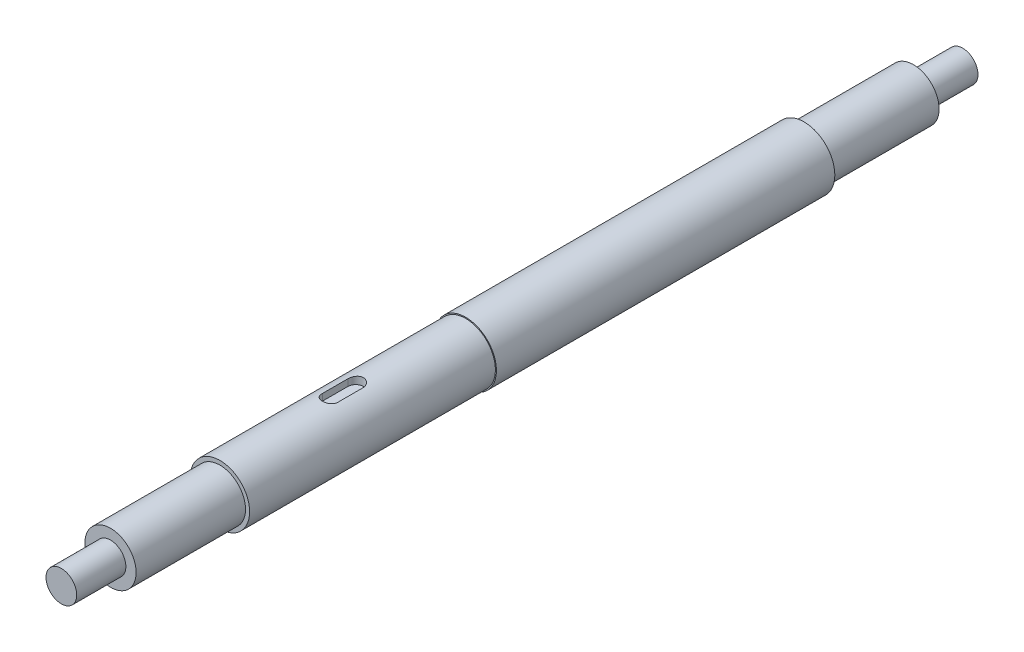
from build123d import *

# Parameters (mm, degrees)
SKETCH1_R           = 9.525
BOSS_EXTRUDE1_DEPTH = 139.7
CUT_EXTRUDE1_REACH  = 232.645
SKETCH3_R           = 9.525
SKETCH3_R_2         = 7.9375
CUT_EXTRUDE2_REACH  = 266.503
SKETCH4_R           = 7.9375
SKETCH4_R_2         = 4.7625
SKETCH5_R           = 9.525
SKETCH5_R_2         = 9.2075
CUT_EXTRUDE3_DEPTH  = 76.2
CUT_EXTRUDE4_DEPTH  = 2.38125


with BuildPart() as part:
    # Sketch1 → Boss-Extrude1 (new, symmetric)
    with BuildSketch(Plane.XY):
        Circle(SKETCH1_R)
    extrude(amount=BOSS_EXTRUDE1_DEPTH, both=True)

    # Sketch3 → Cut-Extrude1 (cut, up to next)
    with BuildSketch(Plane.XY.offset(90.551), mode=Mode.PRIVATE) as cut_extrude1_sk1:
        Circle(SKETCH3_R)
        Circle(SKETCH3_R_2, mode=Mode.SUBTRACT)
    cut_extrude1_tool1 = extrude(cut_extrude1_sk1.sketch, amount=CUT_EXTRUDE1_REACH, mode=Mode.PRIVATE) & part.part
    cut_extrude1 = cut_extrude1_tool1.solids().sort_by_distance((-9.255592, 0, 90.551))[0]
    add(cut_extrude1, mode=Mode.SUBTRACT)

    # Mirror1: Cut-Extrude1 across plane
    add(cut_extrude1.mirror(Plane.XY), mode=Mode.SUBTRACT)

    # Sketch4 → Cut-Extrude2 (cut, up to next)
    with BuildSketch(Plane.XY.offset(124.46), mode=Mode.PRIVATE) as cut_extrude2_sk1:
        Circle(SKETCH4_R)
        Circle(SKETCH4_R_2, mode=Mode.SUBTRACT)
    cut_extrude2_tool1 = extrude(cut_extrude2_sk1.sketch, amount=CUT_EXTRUDE2_REACH, mode=Mode.PRIVATE) & part.part
    cut_extrude2 = cut_extrude2_tool1.solids().sort_by_distance((-7.712994, 0, 124.46))[0]
    add(cut_extrude2, mode=Mode.SUBTRACT)

    # Mirror2: Cut-Extrude2 across plane
    add(cut_extrude2.mirror(Plane.XY), mode=Mode.SUBTRACT)

    # Sketch5 → Cut-Extrude3 (cut)
    with BuildSketch(Plane.XY.offset(90.551)):
        Circle(SKETCH5_R)
        Circle(SKETCH5_R_2, mode=Mode.SUBTRACT)
    extrude(amount=-CUT_EXTRUDE3_DEPTH, mode=Mode.SUBTRACT)

    # Sketch6 → Cut-Extrude4 (cut)
    with BuildSketch(Plane(origin=(0, 9.2075, 0), x_dir=(1, 0, 0), z_dir=(0, 1, 0))):
        with BuildLine():
            Line((-2.38125, -48.48225), (-2.38125, -56.41975))
            ThreePointArc((-2.38125, -56.41975), (0, -58.801), (2.38125, -56.41975))
            Line((2.38125, -56.41975), (2.38125, -48.48225))
            ThreePointArc((2.38125, -48.48225), (0, -46.101), (-2.38125, -48.48225))
        make_face()
    extrude(amount=-CUT_EXTRUDE4_DEPTH, mode=Mode.SUBTRACT)


solid = part.part
